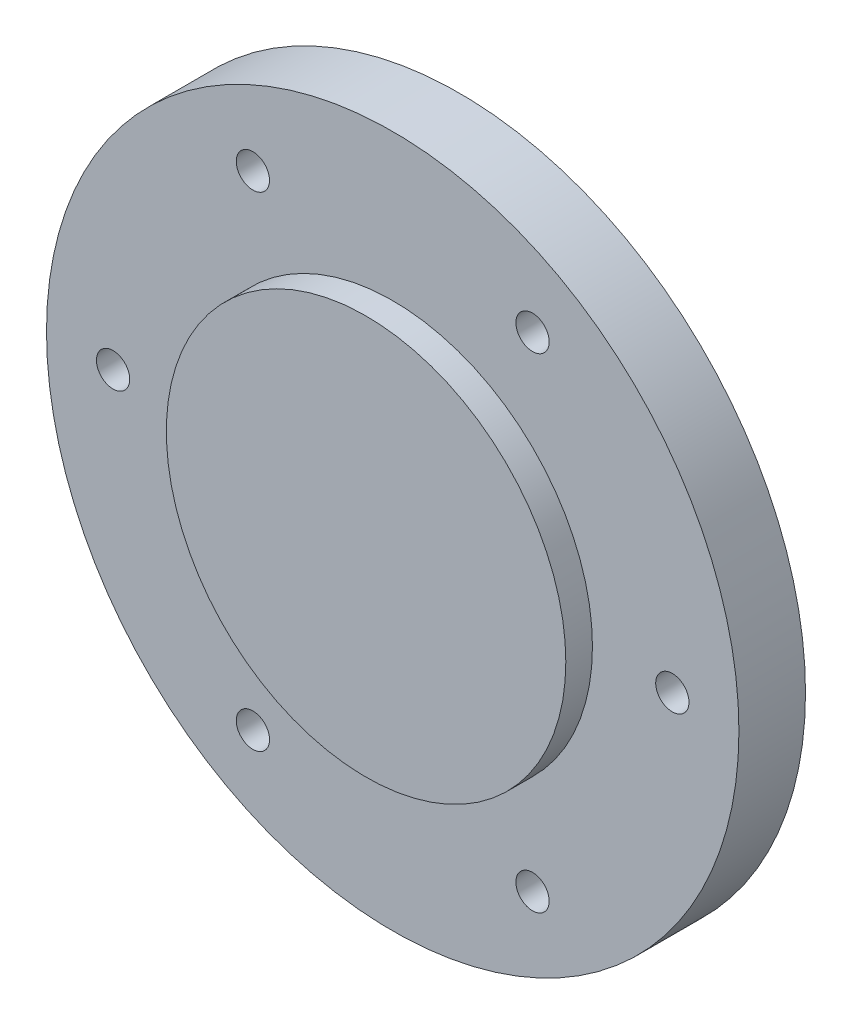
from build123d import *

# Parameters (mm, degrees)
SK_DISC_R                 = 26
OUTPUT_DISC_DEPTH         = 5
SK_PILOT_R                = 15
PILOT_BOSS_DEPTH          = 2
SK_OUTHOLE_R              = 1.25
OUTPUT_TAPPED_HOLE_DEPTH  = 5
OUTPUT_HOLE_PATTERN_COUNT = 6


with BuildPart() as part:
    # SK_Disc → Output_Disc (new body)
    with BuildSketch(Plane.XY):
        Circle(SK_DISC_R)
    extrude(amount=OUTPUT_DISC_DEPTH)

    # SK_Pilot → Pilot_Boss (add)
    with BuildSketch(Plane.XY.offset(5)):
        Circle(SK_PILOT_R)
    extrude(amount=PILOT_BOSS_DEPTH)

    # SK_OutHole → Output_Tapped_Hole (cut)
    with BuildSketch(Plane.XY.offset(5)):
        with Locations((21, 0)):
            Circle(SK_OUTHOLE_R)
    output_tapped_hole = extrude(amount=-OUTPUT_TAPPED_HOLE_DEPTH, mode=Mode.SUBTRACT)

    # Output_Hole_Pattern: Output_Tapped_Hole ×6 about axis
    output_hole_pattern_axis = Axis((0, 0, -0.35), (0, 0, 1))
    for i in range(1, OUTPUT_HOLE_PATTERN_COUNT):
        add(output_tapped_hole.rotate(output_hole_pattern_axis, i * 360 / OUTPUT_HOLE_PATTERN_COUNT), mode=Mode.SUBTRACT)


solid = part.part
